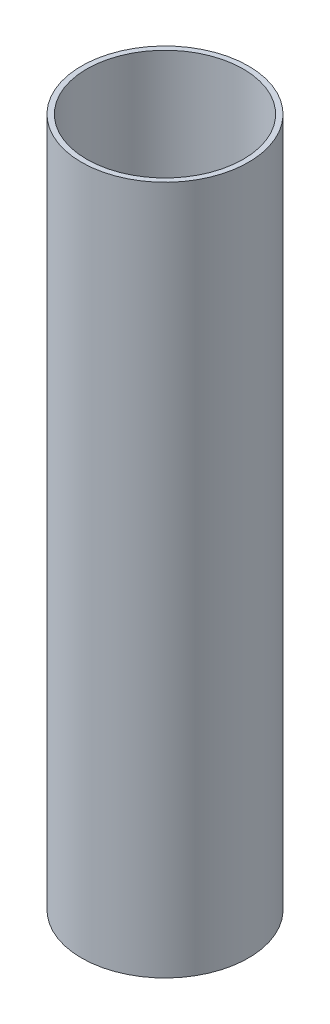
from build123d import *

# Parameters (mm, degrees)
SKETCH1_R           = 40
SKETCH1_R_2         = 37.5
BOSS_EXTRUDE1_DEPTH = 330.2


with BuildPart() as part:
    # Sketch1 → Boss-Extrude1 (new body)
    with BuildSketch(Plane(origin=(0, 0, 0), x_dir=(1, 0, 0), z_dir=(0, 1, 0))):
        Circle(SKETCH1_R)
        Circle(SKETCH1_R_2, mode=Mode.SUBTRACT)
    extrude(amount=BOSS_EXTRUDE1_DEPTH)


solid = part.part
